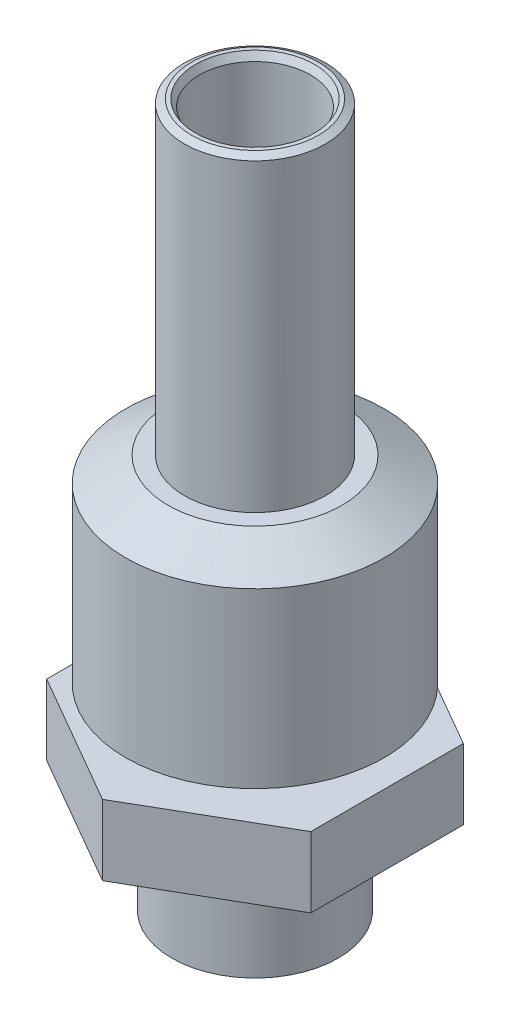
from build123d import *
from OCP.BRepFilletAPI import BRepFilletAPI_MakeChamfer

# Parameters (mm, degrees)
BOSS_EXTRUDE1_DEPTH = 27.432
CHAMFER1_SIZE       = 0.254
CHAMFER1_SIZE2      = 0.146646968


# Read off the part's stored shape, not the designer's step: Cut-Revolve4
with BuildPart() as part:
    # Sketch3 → Boss-Extrude1 (new body)
    with BuildSketch(Plane(origin=(0, 0, 0), x_dir=(1, 0, 0), z_dir=(0, 1, 0))):
        Polygon((4.7625, 2.749630657), (0, 5.499261314), (-4.7625, 2.749630657), (-4.7625, -2.749630657), (0, -5.499261314), (4.7625, -2.749630657), align=None)
    extrude(amount=BOSS_EXTRUDE1_DEPTH)

    # Cut-Revolve4 outline → Cut-Revolve4 (revolve, cut)
    with BuildSketch(Plane.XY):
        Polygon((4.6609, 9.18188181), (3.1369, 8.302), (5.499261314, 8.302), (5.499261314, 27.432), (2.54, 27.432), (2.54, 16.302), (3.1369, 16.302), (4.6609, 15.42211819), align=None)
        Polygon((0.99695, 21.082), (2, 21.082), (2, 27.432), (0, 27.432), (0, 1.391072642), (0.99695, 1.92116036), align=None)
    revolve(axis=Axis((0, 0, 0), (0, 1, 0)), mode=Mode.SUBTRACT)

    # Chamfer1: one chamfer whose edges measure the first distance from different faces: ONE call of the kernel's chamfer builder (chamfer() names one face for all edges)
    chamfer1_edges_1 = [part.edges().sort_by_distance(p)[0] for p in [
        (-2.54, 27.432, 0),
    ]]
    chamfer1_side_1 = [part.faces().sort_by_distance(p)[0] for p in [
        (-2.468157951, 27.432, 0),
    ]]
    chamfer1_edges_2 = [part.edges().sort_by_distance(p)[0] for p in [
        (-2, 27.432, 0),
    ]]
    chamfer1_side_2 = [part.faces().sort_by_distance(p)[0] for p in [
        (-2, 24.257, 0),
    ]]
    chamfer1 = BRepFilletAPI_MakeChamfer(part.part.solid().wrapped)
    for e in chamfer1_edges_1:
        chamfer1.Add(CHAMFER1_SIZE, CHAMFER1_SIZE2, e.wrapped, chamfer1_side_1[0].wrapped)  # the first distance lies on this face
    for e in chamfer1_edges_2:
        chamfer1.Add(CHAMFER1_SIZE, CHAMFER1_SIZE2, e.wrapped, chamfer1_side_2[0].wrapped)  # the first distance lies on this face
    add(Compound.cast(chamfer1.Shape()), mode=Mode.REPLACE)

    # Sketch4 → Cut-Revolve5 (revolve, cut)
    with BuildSketch(Plane.XY, mode=Mode.PRIVATE) as cut_revolve5_sk:
        Polygon((-0.175, 0.762), (-0.5, 0.762), (-3, 2.091273579), (-3, 5.762), (-6.107414125, 5.762), (-6.107414125, 0), (0, 0), (0, 1.524), (-0.175, 1.524), align=None)
    revolve(cut_revolve5_sk.sketch.rotate(Axis((0, 0, 0), (0, 1, 0)), 270), axis=Axis((0, 0, 0), (0, 1, 0)), mode=Mode.SUBTRACT)


solid = part.part
